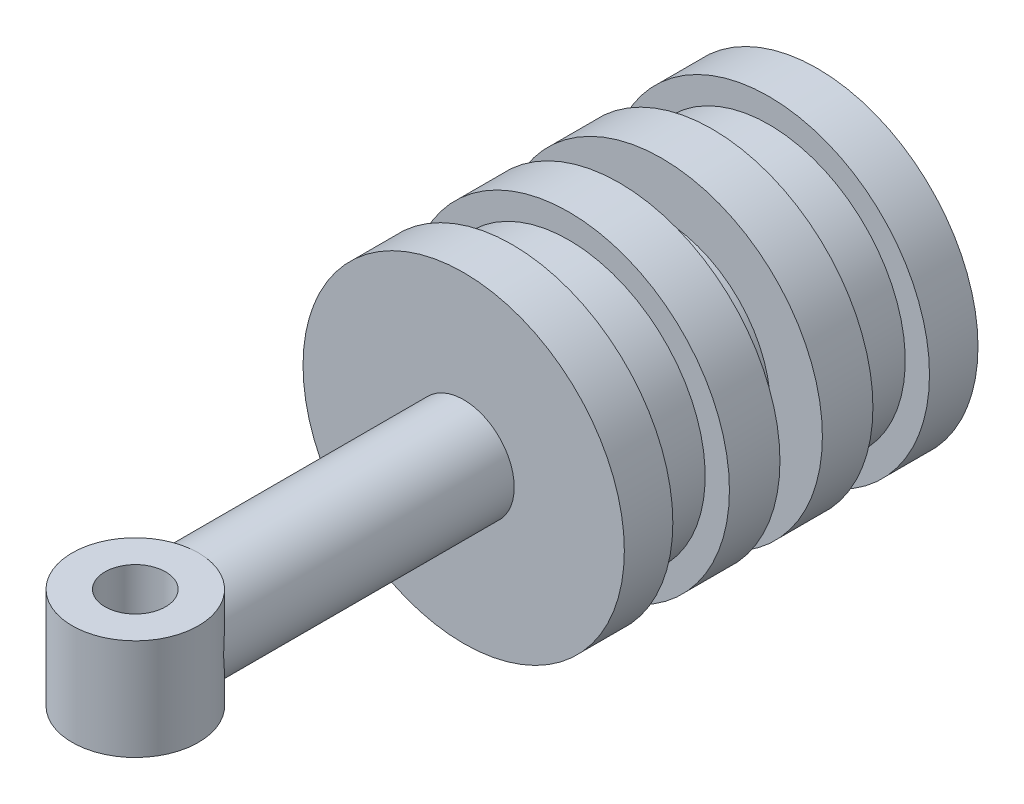
from build123d import *
from build123d.topology import SkipClean

# Parameters (mm, degrees)
SKETCH3_R                = 15.9
BOSS_EXTRUDE1_DEPTH      = 35
SKETCH4_R                = 5
BOSS_EXTRUDE2_DEPTH      = 32.5
SKETCH7_W                = 4.2
SKETCH7_H                = 5.15
SKETCH7_W_2              = 5.6
SKETCH7_H_2              = 2.4
BOSS_EXTRUDE3_DEPTH      = 5
BOSS_EXTRUDE3_DEPTH_BACK = 5
SKETCH8_R                = 6.25
SKETCH8_R_2              = 3
SKETCH9_R                = 3
CUT_EXTRUDE1_DEPTH       = 16


with BuildPart() as part:
    # Sketch3 → Boss-Extrude1 (new body)
    with BuildSketch(Plane.XY):
        Circle(SKETCH3_R)
    extrude(amount=BOSS_EXTRUDE1_DEPTH)

    # Sketch4 → Boss-Extrude2 (add)
    with BuildSketch(Plane.XY.offset(35)):
        Circle(SKETCH4_R)
    extrude(amount=BOSS_EXTRUDE2_DEPTH)

    # Sketch7 → Cut-Revolve1 (revolve, cut)
    with BuildSketch(Plane(origin=(0, 0, 0), x_dir=(0, 0, -1), z_dir=(1, 0, 0))):
        with Locations((-17.5, 13.325)):
            Rectangle(SKETCH7_W, SKETCH7_H)
        with Locations((-27.4, 14.7)):
            Rectangle(SKETCH7_W_2, SKETCH7_H_2)
        with Locations((-7.6, 14.7)):
            Rectangle(SKETCH7_W_2, SKETCH7_H_2)
    revolve(axis=Axis((0, 0, -11.998492927), (0, 0, 1)), mode=Mode.SUBTRACT)

    # Sketch8 → Boss-Extrude3 (add, two sides: drawn at the far end of the back side and taken through both)
    with SkipClean():  # the faces are left unmerged after this step: merging them gives an invalid solid
        with BuildSketch(Plane(origin=(0, 0, 0), x_dir=(1, 0, 0), z_dir=(0, 1, 0)).offset(-BOSS_EXTRUDE3_DEPTH_BACK)):
            with Locations((0, -67.5)):
                Circle(SKETCH8_R)
            with Locations((0, -67.5)):
                Circle(SKETCH8_R_2, mode=Mode.SUBTRACT)
        extrude(amount=BOSS_EXTRUDE3_DEPTH + BOSS_EXTRUDE3_DEPTH_BACK)

    # Sketch9 → Cut-Extrude1 (cut)
    with SkipClean():  # the faces are left unmerged after this step: merging them gives an invalid solid
        with BuildSketch(Plane(origin=(0, 5, 0), x_dir=(1, 0, 0), z_dir=(0, 1, 0))):
            with Locations((0, -67.5)):
                Circle(SKETCH9_R)
        extrude(amount=-CUT_EXTRUDE1_DEPTH, mode=Mode.SUBTRACT)


solid = part.part
